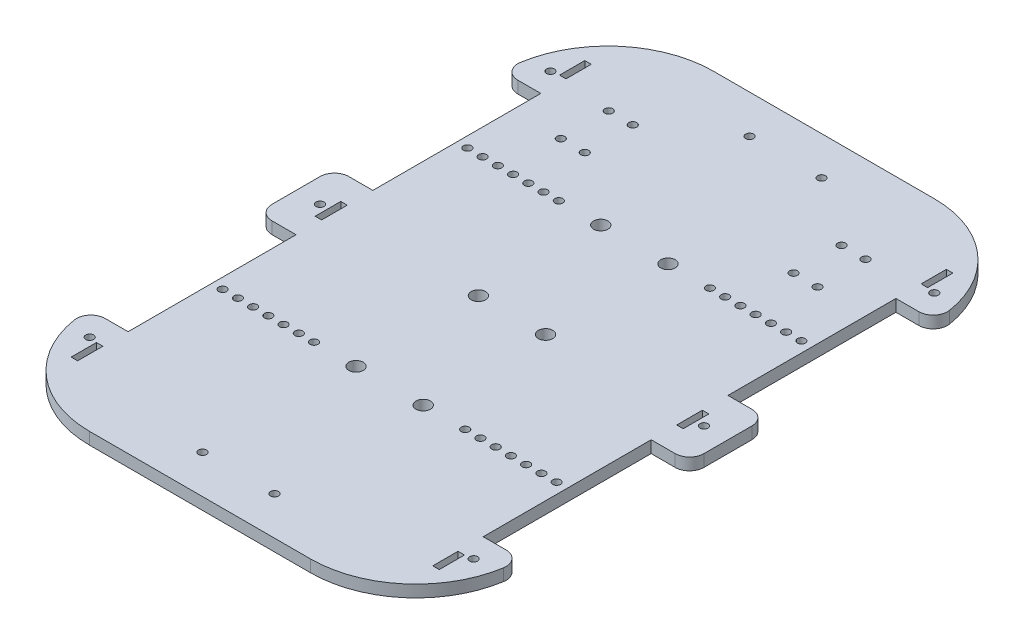
from build123d import *

# Parameters (mm, degrees)
SKETCH2_W           = 2.7
SKETCH2_H           = 10.51
SKETCH2_H_2         = 10.666666666
BOSS_EXTRUDE4_DEPTH = 5
SKETCH5_R           = 1.65
SKETCH5_R_2         = 3
CUT_EXTRUDE1_DEPTH  = 159.192920196


with BuildPart() as part:
    # Sketch2 → Boss-Extrude4 (new body)
    with BuildSketch(Plane(origin=(0, 0, 0), x_dir=(1, 0, 0), z_dir=(0, 1, 0))):
        with BuildLine():
            Line((46, -130), (-46, -130))
            ThreePointArc((-46, -130), (-74.550970119, -119.478980051), (-89.448061775, -92.947368421))
            ThreePointArc((-89.448061775, -92.947368421), (-88.08864154, -88.106685893), (-83.523326079, -86))
            Line((-83.523326079, -86), (-74, -86))
            Line((-74, -86), (-74, -16))
            Line((-74, -16), (-84, -16))
            ThreePointArc((-84, -16), (-88.242640687, -14.242640687), (-90, -10))
            Line((-90, -10), (-90, 10))
            ThreePointArc((-90, 10), (-88.242640687, 14.242640687), (-84, 16))
            Line((-84, 16), (-74, 16))
            Line((-74, 16), (-74, 86))
            Line((-74, 86), (-83.523326079, 86))
            ThreePointArc((-83.523326079, 86), (-88.08864154, 88.106685893), (-89.448061775, 92.947368421))
            ThreePointArc((-89.448061775, 92.947368421), (-74.550970119, 119.478980051), (-46, 130))
            Line((-46, 130), (46, 130))
            ThreePointArc((46, 130), (74.550970119, 119.478980051), (89.448061775, 92.947368421))
            ThreePointArc((89.448061775, 92.947368421), (88.08864154, 88.106685893), (83.523326079, 86))
            Line((83.523326079, 86), (74, 86))
            Line((74, 86), (74, 16))
            Line((74, 16), (84, 16))
            ThreePointArc((84, 16), (88.242640687, 14.242640687), (90, 10))
            Line((90, 10), (90, -10))
            ThreePointArc((90, -10), (88.242640687, -14.242640687), (84, -16))
            Line((84, -16), (74, -16))
            Line((74, -16), (74, -86))
            Line((74, -86), (83.523326079, -86))
            ThreePointArc((83.523326079, -86), (88.08864154, -88.106685893), (89.448061775, -92.947368421))
            ThreePointArc((89.448061775, -92.947368421), (74.550970119, -119.478980051), (46, -130))
        make_face()
        with Locations((-75.35, 101.765)):
            Rectangle(SKETCH2_W, SKETCH2_H, mode=Mode.SUBTRACT)
        with Locations((75.35, 101.765)):
            Rectangle(SKETCH2_W, SKETCH2_H, mode=Mode.SUBTRACT)
        with Locations((75.35, -101.765)):
            Rectangle(SKETCH2_W, SKETCH2_H, mode=Mode.SUBTRACT)
        with Locations((-75.35, -101.765)):
            Rectangle(SKETCH2_W, SKETCH2_H, mode=Mode.SUBTRACT)
        with Locations((-75.35, 0)):
            Rectangle(SKETCH2_W, SKETCH2_H_2, mode=Mode.SUBTRACT)
        with Locations((75.35, 0)):
            Rectangle(SKETCH2_W, SKETCH2_H_2, mode=Mode.SUBTRACT)
    extrude(amount=BOSS_EXTRUDE4_DEPTH)

    # Sketch5 → Cut-Extrude1 (cut, through all)
    with BuildSketch(Plane(origin=(0, 5, 0), x_dir=(1, 0, 0), z_dir=(0, 1, 0))):
        with Locations((-69.6, -51)):
            Circle(SKETCH5_R)
        with Locations((-63.25, -51)):
            Circle(SKETCH5_R)
        with Locations((-56.9, -51)):
            Circle(SKETCH5_R)
        with Locations((-50.55, -51)):
            Circle(SKETCH5_R)
        with Locations((-44.2, -51)):
            Circle(SKETCH5_R)
        with Locations((-37.85, -51)):
            Circle(SKETCH5_R)
        with Locations((-31.5, -51)):
            Circle(SKETCH5_R)
        with Locations((31.5, -51)):
            Circle(SKETCH5_R)
        with Locations((37.85, -51)):
            Circle(SKETCH5_R)
        with Locations((44.2, -51)):
            Circle(SKETCH5_R)
        with Locations((50.55, -51)):
            Circle(SKETCH5_R)
        with Locations((56.9, -51)):
            Circle(SKETCH5_R)
        with Locations((63.25, -51)):
            Circle(SKETCH5_R)
        with Locations((69.6, -51)):
            Circle(SKETCH5_R)
        with Locations((69.6, 51)):
            Circle(SKETCH5_R)
        with Locations((63.25, 51)):
            Circle(SKETCH5_R)
        with Locations((56.9, 51)):
            Circle(SKETCH5_R)
        with Locations((50.55, 51)):
            Circle(SKETCH5_R)
        with Locations((44.2, 51)):
            Circle(SKETCH5_R)
        with Locations((37.85, 51)):
            Circle(SKETCH5_R)
        with Locations((31.5, 51)):
            Circle(SKETCH5_R)
        with Locations((-31.5, 51)):
            Circle(SKETCH5_R)
        with Locations((-37.85, 51)):
            Circle(SKETCH5_R)
        with Locations((-44.2, 51)):
            Circle(SKETCH5_R)
        with Locations((-50.55, 51)):
            Circle(SKETCH5_R)
        with Locations((-56.9, 51)):
            Circle(SKETCH5_R)
        with Locations((-63.25, 51)):
            Circle(SKETCH5_R)
        with Locations((-69.6, 51)):
            Circle(SKETCH5_R)
        with Locations((-14, -51)):
            Circle(SKETCH5_R_2)
        with Locations((14, -51)):
            Circle(SKETCH5_R_2)
        with Locations((14, 51)):
            Circle(SKETCH5_R_2)
        with Locations((-14, 51)):
            Circle(SKETCH5_R_2)
        with Locations((-14, 0)):
            Circle(SKETCH5_R_2)
        with Locations((14, 0)):
            Circle(SKETCH5_R_2)
        with Locations((-80, 96)):
            Circle(SKETCH5_R)
        with Locations((-80, 0)):
            Circle(SKETCH5_R)
        with Locations((80, 0)):
            Circle(SKETCH5_R)
        with Locations((-80, -96)):
            Circle(SKETCH5_R)
        with Locations((80, -96)):
            Circle(SKETCH5_R)
        with Locations((80, 96)):
            Circle(SKETCH5_R)
        with Locations((-15, -114)):
            Circle(SKETCH5_R)
        with Locations((15, -114)):
            Circle(SKETCH5_R)
        with Locations((15, 114)):
            Circle(SKETCH5_R)
        with Locations((-15, 114)):
            Circle(SKETCH5_R)
        with Locations((-53.5, 93.83)):
            Circle(SKETCH5_R)
        with Locations((-53.5, 73.83)):
            Circle(SKETCH5_R)
        with Locations((-43.5, 73.83)):
            Circle(SKETCH5_R)
        with Locations((-43.5, 93.83)):
            Circle(SKETCH5_R)
        with Locations((43.5, 73.83)):
            Circle(SKETCH5_R)
        with Locations((53.5, 73.83)):
            Circle(SKETCH5_R)
        with Locations((43.5, 93.83)):
            Circle(SKETCH5_R)
        with Locations((53.5, 93.83)):
            Circle(SKETCH5_R)
    extrude(amount=-CUT_EXTRUDE1_DEPTH, mode=Mode.SUBTRACT)


solid = part.part
